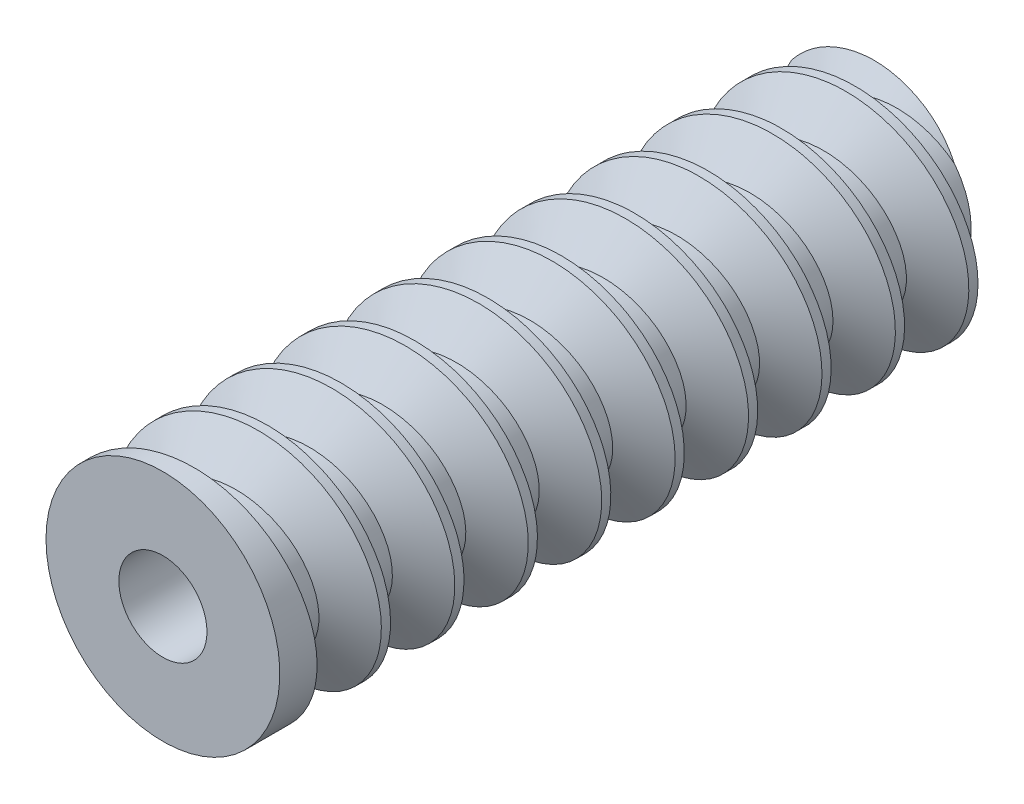
from build123d import *

# Parameters (mm, degrees)
SKETCH1_R           = 3.98
BOSS_EXTRUDE1_DEPTH = 24.89
THREAD1_PITCH       = 2.5
SKETCH7_R           = 1.5
CUT_EXTRUDE1_DEPTH  = 26.518481667


with BuildPart() as part:
    # Sketch1 → Boss-Extrude1 (new body)
    with BuildSketch(Plane.XY):
        Circle(SKETCH1_R)
    extrude(amount=BOSS_EXTRUDE1_DEPTH)

    # Thread1: the profile of Thread Profile1 profile screwed along a right-hand helix of 12 turns, 10 arcs to a turn; built about Z, then put on its axis
    thread1_z = Axis((0, 0, 0), (0, 0, 1))
    thread1_corners = [(3.9803, 0, -0.000173205), (3.9803, 0, 2.187673198), (2.626835312, 0, 1.406249997), (2.626835312, 0, 0.781249997)]
    with BuildLine(mode=Mode.PRIVATE) as thread1_profile:
        Line(thread1_corners[0], thread1_corners[1])
        Line(thread1_corners[1], thread1_corners[2])
        Line(thread1_corners[2], thread1_corners[3])
        Line(thread1_corners[3], thread1_corners[0])
    thread1_cap = Face(thread1_profile.wire())
    thread1_turn_angles = [0, 18, 36, 54, 72, 90, 108, 126, 144, 162, 180, 198, 216, 234, 252, 270, 288, 306, 324, 342, 360]
    thread1_turn_weights = [1, 0.9510565162951535, 1, 0.9510565162951535, 1, 0.9510565162951535, 1, 0.9510565162951535, 1, 0.9510565162951535, 1, 0.9510565162951535, 1, 0.9510565162951535, 1, 0.9510565162951535, 1, 0.9510565162951535, 1, 0.9510565162951535, 1]
    thread1_turn_rails = [Edge.make_bspline([Vector(p[0], p[1], 0).rotate(thread1_z, thread1_turn_angles[k]) / thread1_turn_weights[k] + Vector(0, 0, p[2] + THREAD1_PITCH * thread1_turn_angles[k] / 360) for k in range(21)], [0, 0, 0, 1, 1, 2, 2, 3, 3, 4, 4, 5, 5, 6, 6, 7, 7, 8, 8, 9, 9, 10, 10, 10], 2, thread1_turn_weights) for p in thread1_corners]
    thread1_turn_sides = [Face.make_surface_from_curves(thread1_turn_rails[p[0]], thread1_turn_rails[p[1]]) for p in [(0, 1), (1, 2), (2, 3), (3, 0)]]
    thread1 = Plane(origin=(0, 0, 24.89), x_dir=(-1, 0, 0), z_dir=(0, 0, -1)) * Solid(Shell([*[p.moved(Location((0, 0, THREAD1_PITCH * i))) for i in range(12) for p in thread1_turn_sides], thread1_cap, thread1_cap.rotate(thread1_z, 4320).moved(Location((0, 0, THREAD1_PITCH * 4320 / 360)))]))
    add(thread1, mode=Mode.SUBTRACT)

    # Sketch7 → Cut-Extrude1 (cut, through all)
    with BuildSketch(Plane.XY.offset(24.89)):
        Circle(SKETCH7_R)
    extrude(amount=-CUT_EXTRUDE1_DEPTH, mode=Mode.SUBTRACT)


solid = part.part
